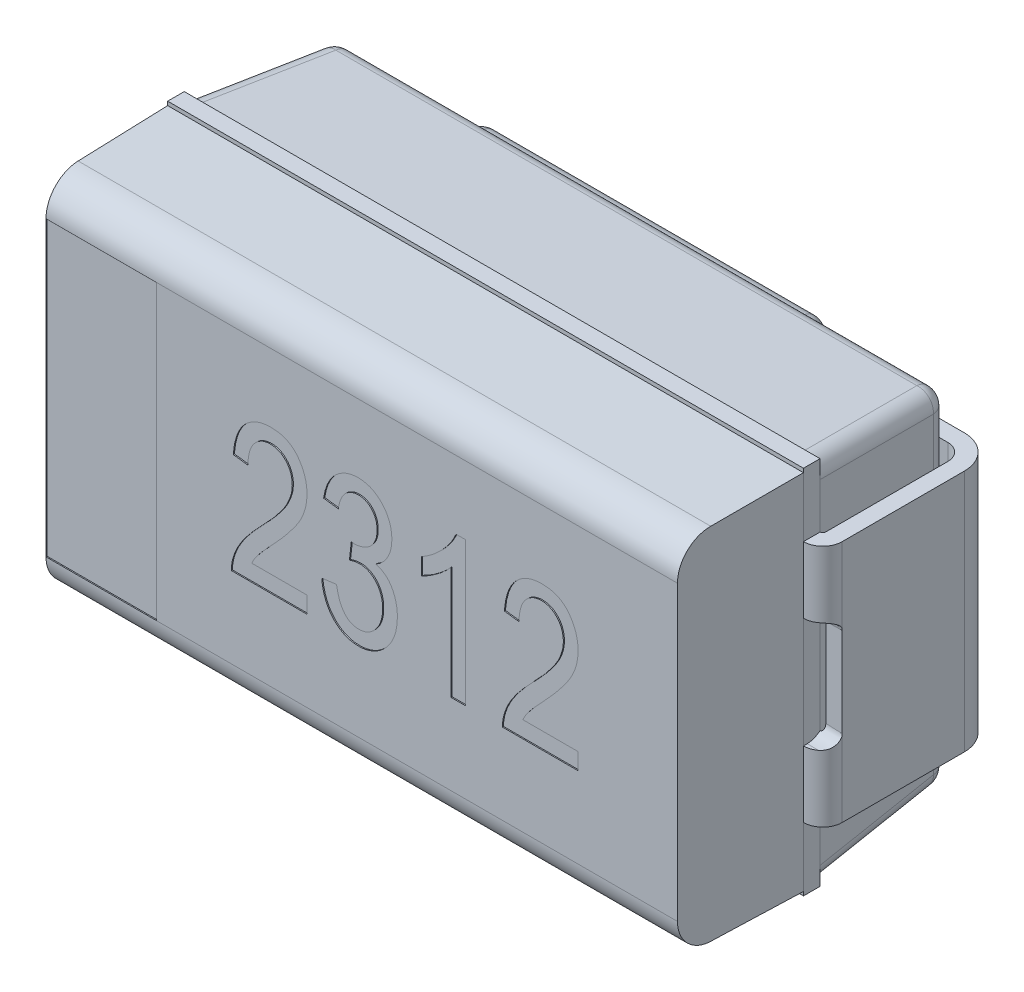
from build123d import *

# Parameters (mm, degrees)
BOSS_EXTRUDE1_START = 1.43
SKETCH1_W           = 5.75
SKETCH1_H           = 3.32
BOSS_EXTRUDE1_DEPTH = 1.26
BOSS_EXTRUDE1_DRAFT = -5
FILLET2_R           = 0.15
SKETCH3_W           = 5.75
SKETCH3_H           = 3.35
BOSS_EXTRUDE2_DEPTH = 0.15
SKETCH4_W           = 5.75
SKETCH4_H           = 3.28
BOSS_EXTRUDE4_DEPTH = 1.12
BOSS_EXTRUDE4_TAPER = 1
FILLET4_R           = 0.30115464
BOSS_EXTRUDE5_START = -0.01
SKETCH5_W           = 3.2
SKETCH5_H           = 2.9
BOSS_EXTRUDE5_DEPTH = 0.16
FILLET5_R           = 0.15
BOSS_EXTRUDE6_DEPTH = 1.1
CUT_EXTRUDE2_DEPTH  = 2.4
CUT_EXTRUDE4_REACH  = 8.723
SKETCH13_W          = 1
SKETCH13_H          = 2.649012974
CUT_EXTRUDE5_DEPTH  = 0.01
CUT_EXTRUDE6_DEPTH  = 0.01


with BuildPart() as part:
    # Sketch1 → Boss-Extrude1 (with draft: the straight prism first)
    with BuildSketch(Plane.XY.offset(BOSS_EXTRUDE1_START)):
        Rectangle(SKETCH1_W, SKETCH1_H)
    extrude(amount=-BOSS_EXTRUDE1_DEPTH)
    # Boss-Extrude1: the draft: its side faces are tilted about the plane it starts from
    boss_extrude1_sides = [part.faces().sort_by_distance(p)[0] for p in [
        (-2.875, 0, 0.8),
        (0, -1.66, 0.8),
        (2.875, 0, 0.8),
        (0, 1.66, 0.8),
    ]]
    draft(boss_extrude1_sides, Plane.XY.offset(BOSS_EXTRUDE1_START), BOSS_EXTRUDE1_DRAFT)

    # Fillet2
    fillet2_edges = [part.edges().sort_by_distance(p)[0] for p in [
        (0, -1.549764284, 0.17),
        (-2.764764284, 0, 0.17),
        (0, 1.549764284, 0.17),
        (2.764764284, 0, 0.17),
        (-2.819882142, 1.604882142, 0.8),
        (-2.819882142, -1.604882142, 0.8),
        (2.819882142, -1.604882142, 0.8),
        (2.819882142, 1.604882142, 0.8),
    ]]
    fillet(fillet2_edges, radius=FILLET2_R)

    # Sketch3 → Boss-Extrude2 (add)
    with BuildSketch(Plane.XY.offset(1.43)):
        Rectangle(SKETCH3_W, SKETCH3_H)
    extrude(amount=BOSS_EXTRUDE2_DEPTH)

    # Sketch4 → Boss-Extrude4 (add)
    with BuildSketch(Plane.XY.offset(1.58)):
        Rectangle(SKETCH4_W, SKETCH4_H)
    extrude(amount=BOSS_EXTRUDE4_DEPTH, taper=BOSS_EXTRUDE4_TAPER)

    # Fillet4
    fillet4_edges = [part.edges().sort_by_distance(p)[0] for p in [
        (0, -1.620450327, 2.7),
        (0, 1.620450327, 2.7),
    ]]
    fillet(fillet4_edges, radius=FILLET4_R)

    # Sketch5 → Boss-Extrude5 (add)
    with BuildSketch(Plane(origin=(0, 0, 0.17), x_dir=(-1, 0, 0), z_dir=(0, 0, -1)).offset(BOSS_EXTRUDE5_START)):
        Rectangle(SKETCH5_W, SKETCH5_H)
    extrude(amount=BOSS_EXTRUDE5_DEPTH)

    # Fillet5
    fillet5_edges = [part.edges().sort_by_distance(p)[0] for p in [
        (0, -1.45, 0.02),
        (1.6, 0, 0.02),
        (0, 1.45, 0.02),
        (-1.6, 0, 0.02),
        (-1.6, 1.45, 0.097405559),
        (-1.6, -1.45, 0.097405559),
        (1.6, 1.45, 0.097405559),
        (1.6, -1.45, 0.097405559),
    ]]
    fillet(fillet5_edges, radius=FILLET5_R - 0.0001)  # a hair under: the kernel refuses the full size

    # Sketch7 → Boss-Extrude6 (add, symmetric)
    with BuildSketch(Plane(origin=(0, 0, 0), x_dir=(1, 0, 0), z_dir=(0, 1, 0))):
        with BuildLine():
            Line((2.875, -1.58), (2.875, -1.43))
            ThreePointArc((2.875, -1.43), (2.89267767, -1.42267767), (2.9, -1.405))
            Line((2.9, -1.405), (2.9, -0.3))
            ThreePointArc((2.9, -0.3), (2.856066017, -0.193933983), (2.75, -0.15))
            Line((2.75, -0.15), (1.779, -0.15))
            Line((1.779, -0.15), (1.779, 0))
            Line((1.779, 0), (2.75, 0))
            ThreePointArc((2.75, 0), (2.962132034, -0.087867966), (3.05, -0.3))
            Line((3.05, -0.3), (3.05, -1.405))
            ThreePointArc((3.05, -1.405), (2.998743687, -1.528743687), (2.875, -1.58))
        make_face()
        with BuildLine():
            Line((-3.05, -0.3), (-3.05, -1.405))
            ThreePointArc((-3.05, -1.405), (-2.998743687, -1.528743687), (-2.875, -1.58))
            Line((-2.875, -1.58), (-2.875, -1.43))
            ThreePointArc((-2.875, -1.43), (-2.89267767, -1.42267767), (-2.9, -1.405))
            Line((-2.9, -1.405), (-2.9, -0.3))
            ThreePointArc((-2.9, -0.3), (-2.856066017, -0.193933983), (-2.75, -0.15))
            Line((-2.75, -0.15), (-1.779, -0.15))
            Line((-1.779, -0.15), (-1.779, 0))
            Line((-1.779, 0), (-2.75, 0))
            ThreePointArc((-2.75, 0), (-2.962132034, -0.087867966), (-3.05, -0.3))
        make_face()
    extrude(amount=BOSS_EXTRUDE6_DEPTH, both=True)

    # Sketch9 → Cut-Extrude2 (cut)
    with BuildSketch(Plane.ZY.offset(2.875)):
        with BuildLine():
            Line((1.58, 0.686667464), (1.58, -0.686667464))
            add(Edge.make_bspline(
                [(1.58, -0.686667464), (1.573977213, -0.681133658), (1.549992927, -0.675599852), (1.477719503, -0.664532239), (1.429750935, -0.658998432), (1.381568653, -0.653464626)],
                knots=[4.39e-07, 4.39e-07, 4.39e-07, 4.39e-07, 0.5, 0.5, 1, 1, 1, 1], degree=3))
            Line((1.381568653, -0.653464626), (0.844643825, -0.547142878))
            ThreePointArc((0.844643825, -0.547142878), (0.757870339, -0.495208775), (0.723781045, -0.40000001))
            Line((0.723781045, -0.40000001), (0.723781045, 0.39999999))
            ThreePointArc((0.723781045, 0.39999999), (0.757870346, 0.49520876), (0.844643844, 0.547142858))
            Line((0.844643844, 0.547142858), (1.381568671, 0.653464606))
            add(Edge.make_bspline(
                [(1.58, 0.686667464), (1.579173952, 0.685908812), (1.576721603, 0.684291293), (1.570741873, 0.681814465), (1.562141058, 0.679237223), (1.551269301, 0.676659956), (1.538263498, 0.674082696), (1.523287156, 0.671505435), (1.506528622, 0.668928173), (1.488198657, 0.666350913), (1.468527704, 0.663773647), (1.447763395, 0.661196405), (1.426165889, 0.658619072), (1.404010381, 0.656042076), (1.389044845, 0.654323242), (1.381568671, 0.653464606)],
                knots=[0.004712512, 0.004712512, 0.004712512, 0.004712512, 0.008437871, 0.012656806, 0.016875741, 0.021094677, 0.025313612, 0.029532547, 0.033751483, 0.037970418, 0.042189353, 0.046408289, 0.050627224, 0.05484616, 0.059065095, 0.059065095, 0.059065095, 0.059065095], degree=3))
        make_face()
    extrude(amount=CUT_EXTRUDE2_DEPTH, mode=Mode.SUBTRACT)

    # Sketch12 → Cut-Extrude4 (cut, up to next)
    with BuildSketch(Plane(origin=(2.875, 0, 0), x_dir=(0, 0, -1), z_dir=(1, 0, 0)), mode=Mode.PRIVATE) as cut_extrude4_sk1:
        with BuildLine():
            Line((-1.58, 0.5), (-1.58, -0.5))
            Line((-1.58, -0.5), (-1.54624552, -0.5))
            add(Edge.make_bspline(
                [(-1.402585729, -0.4), (-1.403312899, -0.407342947), (-1.404786552, -0.422223872), (-1.416870661, -0.442770942), (-1.435397504, -0.46070891), (-1.465618995, -0.4799903), (-1.507677168, -0.496930888), (-1.533015165, -0.498947182), (-1.54624552, -0.5)],
                knots=[1.3e-08, 1.3e-08, 1.3e-08, 1.3e-08, 0.100893534, 0.204466825, 0.321180199, 0.458502981, 0.717254772, 1, 1, 1, 1], degree=3))
            Line((-1.402585729, -0.4), (-1.402585729, 0.4))
            add(Edge.make_bspline(
                [(-1.54624552, 0.5), (-1.537481885, 0.499493839), (-1.520561773, 0.498516585), (-1.489013812, 0.48972933), (-1.457134295, 0.475112741), (-1.428402913, 0.455710176), (-1.406609525, 0.429801236), (-1.403891106, 0.409667944), (-1.402585729, 0.4)],
                knots=[0, 0, 0, 0, 0.195151032, 0.376781703, 0.549697207, 0.724505811, 0.867708557, 0.99999998, 0.99999998, 0.99999998, 0.99999998], degree=3))
            Line((-1.54624552, 0.5), (-1.58, 0.5))
        make_face()
    cut_extrude4_tool1 = extrude(cut_extrude4_sk1.sketch, amount=CUT_EXTRUDE4_REACH, mode=Mode.PRIVATE) & part.part
    add(cut_extrude4_tool1.solids().sort_by_distance((2.875, 6e-06, 1.493478))[0], mode=Mode.SUBTRACT)

    # Sketch13 → Cut-Extrude5 (cut)
    with BuildSketch(Plane.XY.offset(2.7)):
        with Locations((-2.355450327, 0)):
            Rectangle(SKETCH13_W, SKETCH13_H)
    extrude(amount=-CUT_EXTRUDE5_DEPTH, mode=Mode.SUBTRACT)

    # Sketch16 → Cut-Extrude6 (cut)
    with BuildSketch(Plane.XY.offset(2.7)):
        with BuildLine():
            Line((-0.494876071, -0.443533936), (-0.494876071, -0.593630482))
            Line((-0.494876071, -0.593630482), (-1.178649228, -0.593630482))
            add(Edge.make_bspline(
                [(-1.178649228, -0.593630482), (-1.178680887, -0.585809824), (-1.178745029, -0.569965043), (-1.176612512, -0.545808276), (-1.172231073, -0.521066659), (-1.166636422, -0.495410136), (-1.158703818, -0.469176146), (-1.148992839, -0.442237217), (-1.137534737, -0.414660418), (-1.124118346, -0.386282429), (-1.108440617, -0.356831045), (-1.089522142, -0.326429484), (-1.067780123, -0.294532412), (-1.043185807, -0.261334281), (-1.015258187, -0.227149939), (-0.984826184, -0.19147192), (-0.951455491, -0.154374538), (-0.927695488, -0.129719273), (-0.915459103, -0.11702183)],
                knots=[0, 0, 0, 0, 0.672188691, 1.361865275, 2.08134618, 2.831455259, 3.618325166, 4.435686407, 5.292818481, 6.184803937, 7.133719261, 8.159707436, 9.261705982, 10.452168352, 11.710682541, 13.056179633, 14.483934645, 16, 16, 16, 16], degree=3))
            add(Edge.make_bspline(
                [(-0.915459103, -0.11702183), (-0.901239052, -0.102313621), (-0.87385945, -0.073994109), (-0.835325276, -0.032178613), (-0.800313108, 0.00668837), (-0.769522468, 0.043309672), (-0.742406708, 0.077186519), (-0.718693015, 0.108270476), (-0.699514666, 0.137266973), (-0.678807502, 0.171385518), (-0.659066163, 0.212003104), (-0.641613701, 0.259349328), (-0.630337177, 0.305119037), (-0.628962624, 0.335294031), (-0.628295224, 0.349945204)],
                knots=[0, 0, 0, 0, 1.312560889, 2.527233899, 3.64818266, 4.668586789, 5.596397896, 6.432357998, 7.175835261, 7.825761013, 8.992224112, 10.065918602, 11.060925749, 12, 12, 12, 12], degree=3))
            add(Edge.make_bspline(
                [(-0.628295224, 0.349945204), (-0.628388284, 0.358033817), (-0.628570039, 0.373831725), (-0.631658723, 0.39690288), (-0.636063594, 0.418847122), (-0.641879328, 0.439823046), (-0.650125368, 0.459486117), (-0.660005516, 0.47797276), (-0.671578706, 0.495366702), (-0.684785473, 0.511412506), (-0.699349534, 0.525887828), (-0.71469801, 0.538892085), (-0.73123018, 0.549417128), (-0.748266567, 0.558579391), (-0.766382865, 0.565219639), (-0.785197592, 0.570281224), (-0.804884819, 0.573135177), (-0.818252583, 0.573567639), (-0.825036357, 0.573787102)],
                knots=[0, 0, 0, 0, 1.164486654, 2.274364258, 3.346924328, 4.388668322, 5.404300818, 6.412115579, 7.404820287, 8.409522099, 9.400647826, 10.360464378, 11.301161788, 12.219192522, 13.141987859, 14.073903283, 15.022558797, 16, 16, 16, 16], degree=3))
            add(Edge.make_bspline(
                [(-0.825036357, 0.573787102), (-0.832350595, 0.573633658), (-0.846628323, 0.573334129), (-0.867439044, 0.569611788), (-0.887379537, 0.564632031), (-0.906348614, 0.556908862), (-0.924207528, 0.547015954), (-0.941213543, 0.535107956), (-0.957033789, 0.520959782), (-0.971986953, 0.504871615), (-0.985095305, 0.486526006), (-0.997130695, 0.466674051), (-1.006608058, 0.444474823), (-1.014666551, 0.420612835), (-1.020977619, 0.394809936), (-1.025196064, 0.367163437), (-1.028289659, 0.337680082), (-1.028463395, 0.317380956), (-1.028552681, 0.306948797)],
                knots=[0, 0, 0, 0, 0.928788257, 1.813037313, 2.680996359, 3.53827917, 4.408273621, 5.272359245, 6.172129225, 7.102295458, 8.058839945, 9.034325244, 10.048074492, 11.120300332, 12.234644845, 13.420320921, 14.674247329, 16, 16, 16, 16], degree=3))
            Line((-1.028552681, 0.306948797), (-1.161971834, 0.323626191))
            add(Edge.make_bspline(
                [(-1.161971834, 0.323626191), (-1.160596884, 0.339108423), (-1.15792942, 0.369144656), (-1.150930737, 0.412626765), (-1.141218804, 0.452970374), (-1.129690133, 0.490577957), (-1.115185736, 0.524982785), (-1.098969361, 0.556810987), (-1.079749072, 0.585370676), (-1.058315279, 0.611014928), (-1.034847481, 0.633766607), (-1.009477946, 0.653405348), (-0.982241124, 0.669960435), (-0.953448061, 0.683880594), (-0.922503592, 0.694275549), (-0.889962859, 0.701819973), (-0.855561197, 0.706289651), (-0.832085242, 0.706896207), (-0.820085255, 0.707206254)],
                knots=[0, 0, 0, 0, 1.296155121, 2.514599762, 3.669097984, 4.755193195, 5.79120272, 6.77953026, 7.729955905, 8.65570694, 9.562583864, 10.450894749, 11.325630111, 12.216772649, 13.112585423, 14.04224033, 14.999270054, 16, 16, 16, 16], degree=3))
            add(Edge.make_bspline(
                [(-0.820085255, 0.707206254), (-0.807128742, 0.70682593), (-0.781900258, 0.706085375), (-0.745173532, 0.701205708), (-0.710919147, 0.692598305), (-0.6789841, 0.680620969), (-0.649751922, 0.664853137), (-0.622747124, 0.645939191), (-0.598420386, 0.623304168), (-0.576771809, 0.597548706), (-0.557639911, 0.569742592), (-0.540946079, 0.540666959), (-0.526465521, 0.510803587), (-0.515148555, 0.479820179), (-0.505697684, 0.448132555), (-0.49976044, 0.415260374), (-0.495580664, 0.38158292), (-0.495112262, 0.358818345), (-0.494876071, 0.347339361)],
                knots=[0, 0, 0, 0, 1.141256367, 2.222215694, 3.255808886, 4.246221905, 5.218350639, 6.173592628, 7.142736081, 8.136099926, 9.131465336, 10.11177911, 11.087094076, 12.050634184, 13.014356534, 13.995714735, 14.989343724, 16, 16, 16, 16], degree=3))
            add(Edge.make_bspline(
                [(-0.494876071, 0.347339361), (-0.495098608, 0.336997298), (-0.495540781, 0.316447913), (-0.498417155, 0.285787065), (-0.50349449, 0.255538428), (-0.510087184, 0.225411153), (-0.519442263, 0.195871717), (-0.530032711, 0.166450962), (-0.542878103, 0.137480794), (-0.558042408, 0.108395721), (-0.575797838, 0.078166494), (-0.597074717, 0.046241394), (-0.621478463, 0.011767053), (-0.650000318, -0.024642274), (-0.681258256, -0.064033618), (-0.7166332, -0.10541443), (-0.755434965, -0.149149616), (-0.782771938, -0.178825343), (-0.796893254, -0.194154778)],
                knots=[0, 0, 0, 0, 0.78053567, 1.550902233, 2.321464013, 3.094364546, 3.87611052, 4.657966429, 5.453363508, 6.265521698, 7.132350641, 8.097801917, 9.160103787, 10.319208993, 11.587678713, 12.955014444, 14.427067756, 16, 16, 16, 16], degree=3))
            add(Edge.make_bspline(
                [(-0.796893254, -0.194154778), (-0.805857949, -0.203692776), (-0.822990201, -0.221920657), (-0.847251521, -0.24829663), (-0.869022649, -0.272290524), (-0.88877758, -0.29356455), (-0.905539677, -0.312834155), (-0.920072214, -0.329590305), (-0.931946412, -0.344039536), (-0.949742108, -0.36675463), (-0.972187091, -0.398759993), (-0.987693837, -0.428932697), (-0.995197893, -0.443533936)],
                knots=[0, 0, 0, 0, 1.227496676, 2.345844757, 3.360613726, 4.265798447, 5.068085109, 5.75545707, 6.345771879, 6.821573405, 8.46188917, 10, 10, 10, 10], degree=3))
            Line((-0.995197893, -0.443533936), (-0.494876071, -0.443533936))
        make_face()
        with BuildLine():
            Line((-0.361456919, -0.243405207), (-0.228037766, -0.226727813))
            add(Edge.make_bspline(
                [(-0.228037766, -0.226727813), (-0.226317024, -0.236824154), (-0.222963928, -0.256498227), (-0.216366521, -0.284810057), (-0.209166073, -0.31130257), (-0.200820594, -0.335726368), (-0.191723779, -0.358320016), (-0.181636025, -0.37893945), (-0.170357542, -0.39758122), (-0.158165946, -0.41425613), (-0.14502358, -0.429043145), (-0.130990229, -0.441845404), (-0.115934465, -0.452653751), (-0.099999807, -0.4616486), (-0.082934094, -0.468321358), (-0.065072636, -0.473413999), (-0.046152993, -0.476246442), (-0.03321641, -0.476671519), (-0.026606116, -0.476888724)],
                knots=[0, 0, 0, 0, 1.392235382, 2.712957193, 3.95076201, 5.123471921, 6.220028287, 7.260520794, 8.240826993, 9.178593426, 10.065213643, 10.926376853, 11.755607984, 12.580369742, 13.407158359, 14.241002189, 15.101193065, 16, 16, 16, 16], degree=3))
            add(Edge.make_bspline(
                [(-0.026606116, -0.476888724), (-0.019376148, -0.476751158), (-0.005165524, -0.47648077), (0.015659177, -0.472452683), (0.035891523, -0.466953432), (0.055182644, -0.45838814), (0.073872234, -0.447863571), (0.0919837, -0.43516588), (0.108805301, -0.419468444), (0.125186325, -0.402212888), (0.14029476, -0.383056617), (0.1533218, -0.362133755), (0.164293123, -0.33975097), (0.173499576, -0.316175956), (0.180087858, -0.29102551), (0.185515048, -0.26480086), (0.188237417, -0.236947665), (0.188673537, -0.21795939), (0.188897085, -0.208226329)],
                knots=[0, 0, 0, 0, 0.904038564, 1.776903143, 2.648138989, 3.525264603, 4.411852617, 5.332561374, 6.2875971, 7.288147468, 8.311042921, 9.337403868, 10.368883854, 11.429611823, 12.501164111, 13.621320171, 14.780729868, 16, 16, 16, 16], degree=3))
            add(Edge.make_bspline(
                [(0.188897085, -0.208226329), (0.18866078, -0.19910045), (0.188200702, -0.181332655), (0.185670204, -0.155343243), (0.181033725, -0.13072082), (0.174106139, -0.107532643), (0.165902583, -0.08542153), (0.155431405, -0.064838917), (0.143074786, -0.045667001), (0.129095248, -0.028041853), (0.113661117, -0.012157428), (0.09738393, 0.001981042), (0.079999769, 0.013730557), (0.061946696, 0.023623862), (0.042732396, 0.030735267), (0.022916797, 0.03639576), (0.002070454, 0.039522093), (-0.012090637, 0.039911817), (-0.019309756, 0.040110492)],
                knots=[0, 0, 0, 0, 1.208507307, 2.352925112, 3.453685551, 4.520081629, 5.553915499, 6.572344605, 7.570902253, 8.569592363, 9.545641393, 10.499968035, 11.418701314, 12.319183888, 13.218416966, 14.125267075, 15.044288268, 16, 16, 16, 16], degree=3))
            add(Edge.make_bspline(
                [(-0.019309756, 0.040110492), (-0.0258377, 0.039905049), (-0.03975348, 0.0394671), (-0.061665855, 0.035679681), (-0.085916018, 0.030356507), (-0.102559052, 0.025132936), (-0.111296008, 0.022390761)],
                knots=[0, 0, 0, 0, 0.832645691, 1.774971563, 2.831945141, 4, 4, 4, 4], degree=3))
            Line((-0.111296008, 0.022390761), (-0.094618614, 0.173529645))
            Line((-0.094618614, 0.173529645), (-0.074553624, 0.171705555))
            add(Edge.make_bspline(
                [(-0.074553624, 0.171705555), (-0.066810615, 0.171793369), (-0.051701385, 0.171964724), (-0.029603848, 0.175131284), (-0.008524529, 0.179326542), (0.011323306, 0.185693642), (0.030180915, 0.193520535), (0.047754498, 0.20344136), (0.064364661, 0.215009337), (0.079714403, 0.228225024), (0.093494011, 0.243165916), (0.105803421, 0.259205223), (0.115978198, 0.27659363), (0.124433012, 0.294991078), (0.130915902, 0.314663464), (0.135647052, 0.335507434), (0.138161775, 0.357615011), (0.138626516, 0.372697219), (0.138864903, 0.380433565)],
                knots=[0, 0, 0, 0, 1.104467345, 2.155189185, 3.181695374, 4.170183668, 5.126157628, 6.092295424, 7.04536858, 8.012620263, 8.977961638, 9.942904556, 10.893715412, 11.848320646, 12.828840281, 13.845861792, 14.895045293, 16, 16, 16, 16], degree=3))
            add(Edge.make_bspline(
                [(0.138864903, 0.380433565), (0.13826692, 0.394291449), (0.137117703, 0.420923823), (0.128296154, 0.458856087), (0.112924202, 0.492432053), (0.091762761, 0.521138699), (0.066297683, 0.544271684), (0.037850175, 0.561607368), (0.006301019, 0.571878799), (-0.015674779, 0.573143175), (-0.026866701, 0.573787102)],
                knots=[0, 0, 0, 0, 1.168747258, 2.246123166, 3.262822778, 4.26410748, 5.234436762, 6.148309006, 7.056963545, 8, 8, 8, 8], degree=3))
            add(Edge.make_bspline(
                [(-0.026866701, 0.573787102), (-0.038496118, 0.573246385), (-0.061119367, 0.572194502), (-0.093469149, 0.562159987), (-0.123231333, 0.546788259), (-0.14492675, 0.528299945), (-0.160301093, 0.510795456), (-0.171148846, 0.496045066), (-0.180788021, 0.479642797), (-0.188957291, 0.461442191), (-0.196819765, 0.441945701), (-0.202380207, 0.420488202), (-0.207934169, 0.397723649), (-0.210194127, 0.381849949), (-0.211360372, 0.373658373)],
                knots=[0, 0, 0, 0, 1.389180941, 2.702438466, 4.019316734, 5.377896697, 6.085434137, 6.807430375, 7.567469407, 8.358691296, 9.195188439, 10.081130764, 11.009773198, 12, 12, 12, 12], degree=3))
            Line((-0.211360372, 0.373658373), (-0.344779525, 0.390335767))
            add(Edge.make_bspline(
                [(-0.344779525, 0.390335767), (-0.342594874, 0.403049999), (-0.338333273, 0.427851668), (-0.329429791, 0.463539903), (-0.318833468, 0.496880086), (-0.306003862, 0.527688627), (-0.291436422, 0.556232987), (-0.274954719, 0.582392705), (-0.256773424, 0.606339528), (-0.236260898, 0.627412042), (-0.214459536, 0.646180268), (-0.191356678, 0.662388855), (-0.16736423, 0.67634012), (-0.142086741, 0.687579499), (-0.115761562, 0.696491803), (-0.088256883, 0.702728565), (-0.059714029, 0.706415526), (-0.040341033, 0.706940157), (-0.030514881, 0.707206254)],
                knots=[0, 0, 0, 0, 1.259750421, 2.457396855, 3.589696629, 4.673763457, 5.713494597, 6.716289503, 7.690389722, 8.644478697, 9.583164327, 10.496506905, 11.397350125, 12.289843847, 13.194037124, 14.107891875, 15.040306322, 16, 16, 16, 16], degree=3))
            add(Edge.make_bspline(
                [(-0.030514881, 0.707206254), (-0.020161312, 0.706900848), (0.000207755, 0.706300007), (0.030146016, 0.701689809), (0.058938459, 0.694504041), (0.086508431, 0.684027634), (0.112610875, 0.670227675), (0.137888749, 0.654045446), (0.161915837, 0.63465721), (0.184315572, 0.612379728), (0.204876526, 0.588001884), (0.222910681, 0.561809226), (0.238400401, 0.534243946), (0.250700311, 0.504906728), (0.260314382, 0.474093747), (0.267339759, 0.441754893), (0.271641666, 0.407824554), (0.272066676, 0.384702723), (0.272284055, 0.37287662)],
                knots=[0, 0, 0, 0, 0.987546189, 1.94284647, 2.883618689, 3.814886987, 4.749064414, 5.696240478, 6.674807358, 7.688712876, 8.706405422, 9.713376545, 10.718845743, 11.717906576, 12.742863162, 13.794678478, 14.872046121, 16, 16, 16, 16], degree=3))
            add(Edge.make_bspline(
                [(0.272284055, 0.37287662), (0.271882646, 0.358597086), (0.271098698, 0.330709364), (0.263542266, 0.290255873), (0.25155023, 0.252303584), (0.234824299, 0.217104937), (0.213981841, 0.184840769), (0.188947445, 0.156301241), (0.160376559, 0.131004017), (0.138652515, 0.11771426), (0.127659779, 0.110989417)],
                knots=[0, 0, 0, 0, 1.090109576, 2.128968013, 3.132278696, 4.123864162, 5.09769889, 6.057339906, 7.016980922, 8, 8, 8, 8], degree=3))
            add(Edge.make_bspline(
                [(0.127659779, 0.110989417), (0.137757324, 0.107882508), (0.157486647, 0.101812002), (0.184704737, 0.088141529), (0.209522994, 0.072265865), (0.231698558, 0.053223673), (0.251421538, 0.031008508), (0.26903288, 0.005466117), (0.284164217, -0.023647619), (0.297834612, -0.055607066), (0.308547685, -0.090389464), (0.316778461, -0.127299402), (0.321445827, -0.166325752), (0.322021707, -0.193013518), (0.322316237, -0.206662823)],
                knots=[0, 0, 0, 0, 0.945190562, 1.846782401, 2.71900073, 3.580139159, 4.456653473, 5.37426406, 6.352713278, 7.392141409, 8.485180558, 9.608884637, 10.777077804, 12, 12, 12, 12], degree=3))
            add(Edge.make_bspline(
                [(0.322316237, -0.206662823), (0.322060685, -0.221185151), (0.321561767, -0.24953723), (0.316344245, -0.29109277), (0.308447863, -0.330617486), (0.297183809, -0.36825266), (0.282628099, -0.403707126), (0.264652799, -0.437183641), (0.243636964, -0.46868567), (0.219440632, -0.497771387), (0.19298337, -0.52381328), (0.165259189, -0.54708519), (0.136058765, -0.566608456), (0.1056308, -0.582737275), (0.073839202, -0.594984809), (0.040854094, -0.603935859), (0.00648464, -0.609222627), (-0.016859594, -0.609942854), (-0.028690791, -0.610307876)],
                knots=[0, 0, 0, 0, 1.16797173, 2.280242353, 3.364490462, 4.408173669, 5.436152277, 6.443028727, 7.460738993, 8.478233232, 9.481512989, 10.444418881, 11.386528098, 12.302557467, 13.209825675, 14.12198051, 15.04819242, 16, 16, 16, 16], degree=3))
            add(Edge.make_bspline(
                [(-0.028690791, -0.610307876), (-0.039652893, -0.61001841), (-0.06124589, -0.609448225), (-0.092948217, -0.604605483), (-0.123368278, -0.596833235), (-0.152391667, -0.585748162), (-0.180357394, -0.571886112), (-0.206832029, -0.554625794), (-0.232145114, -0.534293616), (-0.255930452, -0.511028511), (-0.277665598, -0.484985438), (-0.297407328, -0.456908537), (-0.314747537, -0.42664966), (-0.328862475, -0.393912605), (-0.340941599, -0.359352208), (-0.350602, -0.322693014), (-0.357686382, -0.283831878), (-0.360182613, -0.257067965), (-0.361456919, -0.243405207)],
                knots=[0, 0, 0, 0, 0.959274814, 1.889566238, 2.800731978, 3.703256649, 4.604498869, 5.528396462, 6.464265966, 7.442996794, 8.436156864, 9.429840861, 10.444772988, 11.483305447, 12.546329121, 13.647537524, 14.799087218, 16, 16, 16, 16], degree=3))
        make_face()
        with BuildLine():
            Line((0.939379818, -0.593630482), (0.805960665, -0.593630482))
            Line((0.805960665, -0.593630482), (0.805960665, 0.423690555))
            add(Edge.make_bspline(
                [(0.805960665, 0.423690555), (0.797766908, 0.414258838), (0.780785354, 0.394711614), (0.751306248, 0.366912737), (0.718455042, 0.338246423), (0.682084394, 0.310429971), (0.6450256, 0.283786312), (0.608423153, 0.26035275), (0.573648897, 0.239963785), (0.55032028, 0.22888144), (0.53912236, 0.223561827)],
                knots=[0, 0, 0, 0, 0.892555828, 1.849821039, 2.893015883, 4.008277588, 5.121255548, 6.154629642, 7.114207698, 8, 8, 8, 8], degree=3))
            Line((0.53912236, 0.223561827), (0.53912236, 0.373658373))
            add(Edge.make_bspline(
                [(0.53912236, 0.373658373), (0.557118321, 0.384489027), (0.592956147, 0.406057595), (0.643169633, 0.44342132), (0.690605663, 0.483749318), (0.733846388, 0.527464137), (0.772563708, 0.572527571), (0.805795674, 0.617500933), (0.833043781, 0.661906388), (0.84640985, 0.692452219), (0.852865836, 0.707206254)],
                knots=[0, 0, 0, 0, 1.082272232, 2.155277244, 3.222407096, 4.289527553, 5.32168536, 6.282742408, 7.170542132, 8, 8, 8, 8], degree=3))
            Line((0.852865836, 0.707206254), (0.939379818, 0.707206254))
            Line((0.939379818, 0.707206254), (0.939379818, -0.593630482))
        make_face()
        with BuildLine():
            Line((1.956700855, -0.443533936), (1.956700855, -0.593630482))
            Line((1.956700855, -0.593630482), (1.272927699, -0.593630482))
            add(Edge.make_bspline(
                [(1.272927699, -0.593630482), (1.27289604, -0.585809824), (1.272831898, -0.569965043), (1.274964415, -0.545808276), (1.279345854, -0.521066659), (1.284940504, -0.495410136), (1.292873108, -0.469176146), (1.302584088, -0.442237217), (1.314042189, -0.414660418), (1.327458581, -0.386282429), (1.34313631, -0.356831045), (1.362054784, -0.326429484), (1.383796803, -0.294532412), (1.408391119, -0.261334281), (1.43631874, -0.227149939), (1.466750743, -0.19147192), (1.500121435, -0.154374538), (1.523881439, -0.129719273), (1.536117824, -0.11702183)],
                knots=[0, 0, 0, 0, 0.672188691, 1.361865275, 2.08134618, 2.831455259, 3.618325166, 4.435686407, 5.292818481, 6.184803937, 7.133719261, 8.159707436, 9.261705982, 10.452168352, 11.710682541, 13.056179633, 14.483934645, 16, 16, 16, 16], degree=3))
            add(Edge.make_bspline(
                [(1.536117824, -0.11702183), (1.550337874, -0.102313621), (1.577717476, -0.073994109), (1.616251651, -0.032178613), (1.651263819, 0.00668837), (1.682054459, 0.043309672), (1.709170219, 0.077186519), (1.732883911, 0.108270476), (1.75206226, 0.137266973), (1.772769424, 0.171385518), (1.792510763, 0.212003104), (1.809963225, 0.259349328), (1.82123975, 0.305119037), (1.822614302, 0.335294031), (1.823281703, 0.349945204)],
                knots=[0, 0, 0, 0, 1.312560889, 2.527233899, 3.64818266, 4.668586789, 5.596397896, 6.432357998, 7.175835261, 7.825761013, 8.992224112, 10.065918602, 11.060925749, 12, 12, 12, 12], degree=3))
            add(Edge.make_bspline(
                [(1.823281703, 0.349945204), (1.823188643, 0.358033817), (1.823006887, 0.373831725), (1.819918203, 0.39690288), (1.815513333, 0.418847122), (1.809697599, 0.439823046), (1.801451558, 0.459486117), (1.791571411, 0.47797276), (1.779998221, 0.495366702), (1.766791453, 0.511412506), (1.752227393, 0.525887828), (1.736878917, 0.538892085), (1.720346747, 0.549417128), (1.703310359, 0.558579391), (1.685194061, 0.565219639), (1.666379335, 0.570281224), (1.646692108, 0.573135177), (1.633324343, 0.573567639), (1.62654057, 0.573787102)],
                knots=[0, 0, 0, 0, 1.164486654, 2.274364258, 3.346924328, 4.388668322, 5.404300818, 6.412115579, 7.404820287, 8.409522099, 9.400647826, 10.360464378, 11.301161788, 12.219192522, 13.141987859, 14.073903283, 15.022558797, 16, 16, 16, 16], degree=3))
            add(Edge.make_bspline(
                [(1.62654057, 0.573787102), (1.619226332, 0.573633658), (1.604948603, 0.573334129), (1.584137882, 0.569611788), (1.56419739, 0.564632031), (1.545228312, 0.556908862), (1.527369399, 0.547015954), (1.510363383, 0.535107956), (1.494543137, 0.520959782), (1.479589974, 0.504871615), (1.466481622, 0.486526006), (1.454446231, 0.466674051), (1.444968868, 0.444474823), (1.436910375, 0.420612835), (1.430599308, 0.394809936), (1.426380862, 0.367163437), (1.423287268, 0.337680082), (1.423113532, 0.317380956), (1.423024245, 0.306948797)],
                knots=[0, 0, 0, 0, 0.928788257, 1.813037313, 2.680996359, 3.53827917, 4.408273621, 5.272359245, 6.172129225, 7.102295458, 8.058839945, 9.034325244, 10.048074492, 11.120300332, 12.234644845, 13.420320921, 14.674247329, 16, 16, 16, 16], degree=3))
            Line((1.423024245, 0.306948797), (1.289605093, 0.323626191))
            add(Edge.make_bspline(
                [(1.289605093, 0.323626191), (1.290980042, 0.339108423), (1.293647506, 0.369144656), (1.30064619, 0.412626765), (1.310358123, 0.452970374), (1.321886794, 0.490577957), (1.336391191, 0.524982785), (1.352607565, 0.556810987), (1.371827854, 0.585370676), (1.393261647, 0.611014928), (1.416729445, 0.633766607), (1.44209898, 0.653405348), (1.469335803, 0.669960435), (1.498128865, 0.683880594), (1.529073335, 0.694275549), (1.561614068, 0.701819973), (1.59601573, 0.706289651), (1.619491684, 0.706896207), (1.631491671, 0.707206254)],
                knots=[0, 0, 0, 0, 1.296155121, 2.514599762, 3.669097984, 4.755193195, 5.79120272, 6.77953026, 7.729955905, 8.65570694, 9.562583864, 10.450894749, 11.325630111, 12.216772649, 13.112585423, 14.04224033, 14.999270054, 16, 16, 16, 16], degree=3))
            add(Edge.make_bspline(
                [(1.631491671, 0.707206254), (1.644448184, 0.70682593), (1.669676668, 0.706085375), (1.706403394, 0.701205708), (1.74065778, 0.692598305), (1.772592827, 0.680620969), (1.801825005, 0.664853137), (1.828829802, 0.645939191), (1.853156541, 0.623304168), (1.874805118, 0.597548706), (1.893937016, 0.569742592), (1.910630847, 0.540666959), (1.925111406, 0.510803587), (1.936428371, 0.479820179), (1.945879243, 0.448132555), (1.951816486, 0.415260374), (1.955996263, 0.38158292), (1.956464665, 0.358818345), (1.956700855, 0.347339361)],
                knots=[0, 0, 0, 0, 1.141256367, 2.222215694, 3.255808886, 4.246221905, 5.218350639, 6.173592628, 7.142736081, 8.136099926, 9.131465336, 10.11177911, 11.087094076, 12.050634184, 13.014356534, 13.995714735, 14.989343724, 16, 16, 16, 16], degree=3))
            add(Edge.make_bspline(
                [(1.956700855, 0.347339361), (1.956478319, 0.336997298), (1.956036146, 0.316447913), (1.953159771, 0.285787065), (1.948082437, 0.255538428), (1.941489743, 0.225411153), (1.932134664, 0.195871717), (1.921544216, 0.166450962), (1.908698824, 0.137480794), (1.893534519, 0.108395721), (1.875779088, 0.078166494), (1.854502209, 0.046241394), (1.830098464, 0.011767053), (1.801576609, -0.024642274), (1.770318671, -0.064033618), (1.734943726, -0.10541443), (1.696141961, -0.149149616), (1.668804989, -0.178825343), (1.654683672, -0.194154778)],
                knots=[0, 0, 0, 0, 0.78053567, 1.550902233, 2.321464013, 3.094364546, 3.87611052, 4.657966429, 5.453363508, 6.265521698, 7.132350641, 8.097801917, 9.160103787, 10.319208993, 11.587678713, 12.955014444, 14.427067756, 16, 16, 16, 16], degree=3))
            add(Edge.make_bspline(
                [(1.654683672, -0.194154778), (1.645718978, -0.203692776), (1.628586726, -0.221920657), (1.604325405, -0.24829663), (1.582554277, -0.272290524), (1.562799346, -0.29356455), (1.546037249, -0.312834155), (1.531504712, -0.329590305), (1.519630514, -0.344039536), (1.501834818, -0.36675463), (1.479389835, -0.398759993), (1.46388309, -0.428932697), (1.456379033, -0.443533936)],
                knots=[0, 0, 0, 0, 1.227496676, 2.345844757, 3.360613726, 4.265798447, 5.068085109, 5.75545707, 6.345771879, 6.821573405, 8.46188917, 10, 10, 10, 10], degree=3))
            Line((1.456379033, -0.443533936), (1.956700855, -0.443533936))
        make_face()
    extrude(amount=-CUT_EXTRUDE6_DEPTH, mode=Mode.SUBTRACT)


solid = part.part
